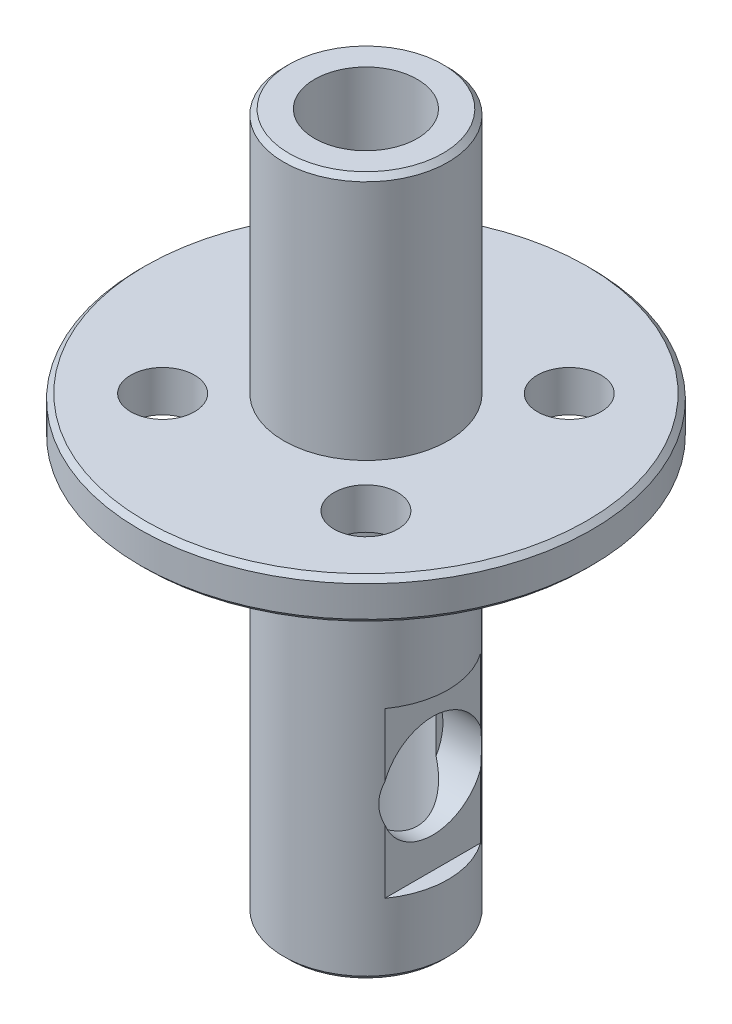
from build123d import *

# Parameters (mm, degrees)
SKETCH2_R           = 11
BOSS_EXTRUDE1_DEPTH = 2
SKETCH3_R           = 4
BOSS_EXTRUDE2_DEPTH = 12
BOSS_EXTRUDE3_START = 20
SKETCH4_R           = 4
BOSS_EXTRUDE3_DEPTH = 20
SKETCH5_R           = 2.5
CUT_EXTRUDE1_DEPTH  = 38.389838192
SKETCH7_W           = 5
SKETCH7_H           = 8
CUT_EXTRUDE2_DEPTH  = 0.75
SKETCH8_R           = 2.5
CUT_EXTRUDE3_DEPTH  = 2
SKETCH9_R           = 1.55
CUT_EXTRUDE5_DEPTH  = 27.944387252
CHAMFER1_SIZE       = 0.25


with BuildPart() as part:
    # Sketch2 → Boss-Extrude1 (new body)
    with BuildSketch(Plane(origin=(0, 0, 0), x_dir=(1, 0, 0), z_dir=(0, 1, 0))):
        Circle(SKETCH2_R)
    extrude(amount=BOSS_EXTRUDE1_DEPTH)

    # Sketch3 → Boss-Extrude2 (add)
    with BuildSketch(Plane(origin=(0, 2, 0), x_dir=(1, 0, 0), z_dir=(0, 1, 0))):
        Circle(SKETCH3_R)
    extrude(amount=BOSS_EXTRUDE2_DEPTH)

    # Sketch4 → Boss-Extrude3 (add)
    with BuildSketch(Plane.XZ.offset(BOSS_EXTRUDE3_START)):
        Circle(SKETCH4_R)
    extrude(amount=-BOSS_EXTRUDE3_DEPTH)

    # Sketch5 → Cut-Extrude1 (cut, through all)
    with BuildSketch(Plane(origin=(0, 14, 0), x_dir=(1, 0, 0), z_dir=(0, 1, 0))):
        Circle(SKETCH5_R)
    extrude(amount=-CUT_EXTRUDE1_DEPTH, mode=Mode.SUBTRACT)

    # Sketch7 → Cut-Extrude2 (cut)
    with BuildSketch(Plane(origin=(4, 0, 0), x_dir=(0, 0, -1), z_dir=(1, 0, 0))):
        with Locations((0, -12.5)):
            Rectangle(SKETCH7_W, SKETCH7_H)
    extrude(amount=-CUT_EXTRUDE2_DEPTH, mode=Mode.SUBTRACT)

    # Sketch8 → Cut-Extrude3 (cut)
    with BuildSketch(Plane(origin=(3.25, 0, 0), x_dir=(0, 0, -1), z_dir=(1, 0, 0))):
        with Locations((0, -12.5)):
            Circle(SKETCH8_R)
    extrude(amount=-CUT_EXTRUDE3_DEPTH, mode=Mode.SUBTRACT)

    # Sketch9 → Cut-Extrude5 (cut, through all)
    with BuildSketch(Plane(origin=(0, 2, 0), x_dir=(1, 0, 0), z_dir=(0, 1, 0))):
        with Locations((4.949747468, 4.949747468)):
            Circle(SKETCH9_R)
        with Locations((4.949747468, -4.949747468)):
            Circle(SKETCH9_R)
        with Locations((-4.949747468, -4.949747468)):
            Circle(SKETCH9_R)
        with Locations((-4.949747468, 4.949747468)):
            Circle(SKETCH9_R)
    extrude(amount=-CUT_EXTRUDE5_DEPTH, mode=Mode.SUBTRACT)

    # Chamfer1
    chamfer1_edges = [part.edges().sort_by_distance(p)[0] for p in [
        (-4, -20, 0),
        (-4, 14, 0),
        (-11, 0, 0),
        (-11, 2, 0),
    ]]
    chamfer(chamfer1_edges, length=CHAMFER1_SIZE)


solid = part.part
